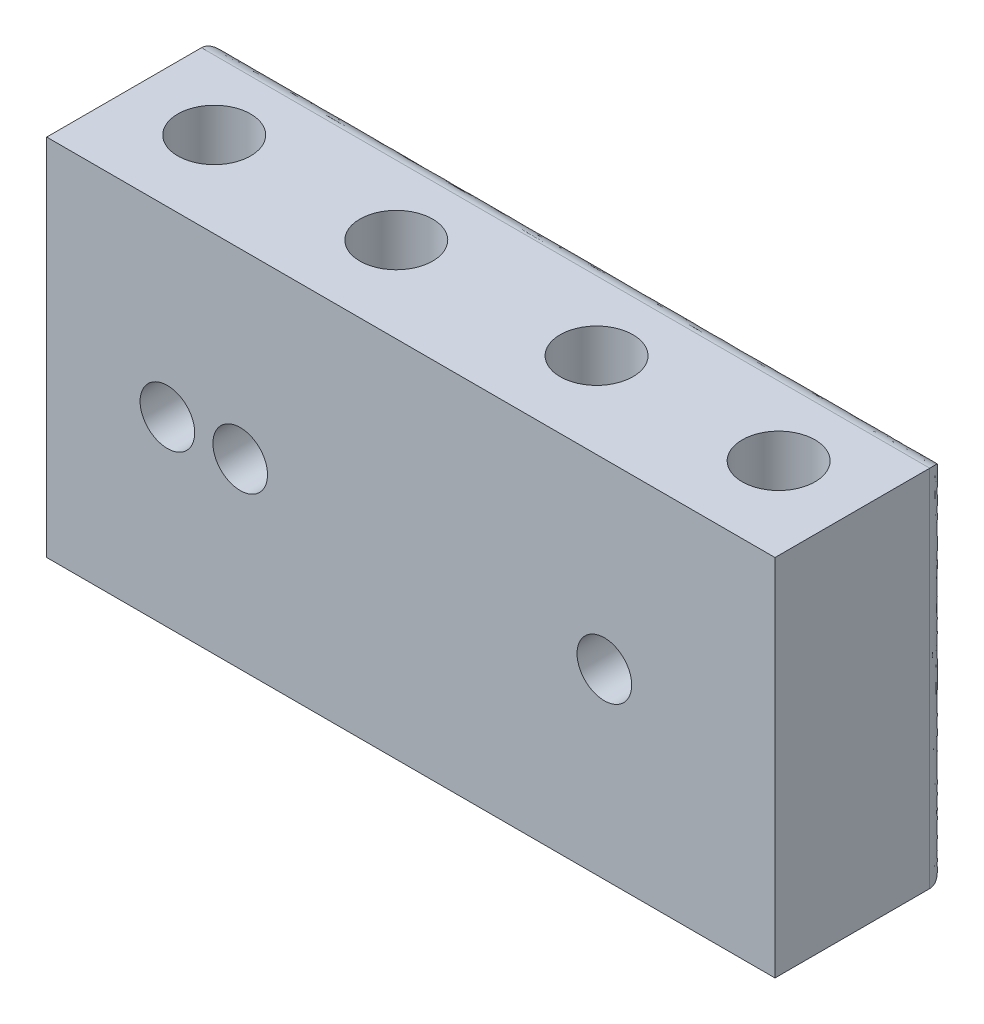
from build123d import *

# Parameters (mm, degrees)
SKETCH1_W           = 40
SKETCH1_H           = 20
BOSS_EXTRUDE1_DEPTH = 9.5
CUT_EXTRUDE1_DEPTH  = 2
FILLET1_R           = 1
SKETCH4_R           = 2
CUT_EXTRUDE2_DEPTH  = 30.837057496
SKETCH5_R           = 1.5
CUT_EXTRUDE3_DEPTH  = 25.295061227


with BuildPart() as part:
    # Sketch1 → Boss-Extrude1 (new body)
    with BuildSketch(Plane.XY):
        Rectangle(SKETCH1_W, SKETCH1_H)
    extrude(amount=BOSS_EXTRUDE1_DEPTH)

    # Sketch3 → Cut-Extrude1 (cut)
    with BuildSketch(Plane(origin=(0, 0, 0), x_dir=(-1, 0, 0), z_dir=(0, 0, -1))):
        with BuildLine():
            Line((13.371397425, -3.45), (1.371397425, -3.45))
            add(Edge.make_bspline(
                [(-6.426606991, -6.332711355), (-3.012827406, -3.55467535), (1.371397425, -3.45)],
                knots=[0, 0, 0, 1, 1, 1], degree=2))
            ThreePointArc((-6.426606991, -6.332711355), (-18.228602575, 0), (-6.426606991, 6.332711355))
            add(Edge.make_bspline(
                [(-6.426606991, 6.332711355), (-3.012827406, 3.55467535), (1.371397425, 3.45)],
                knots=[0, 0, 0, 1, 1, 1], degree=2))
            Line((1.371397425, 3.45), (13.371397425, 3.45))
            ThreePointArc((13.371397425, 3.45), (16.821397425, 0), (13.371397425, -3.45))
        make_face()
    extrude(amount=-CUT_EXTRUDE1_DEPTH, mode=Mode.SUBTRACT)

    # Fillet1
    fillet1_edges = [part.edges().sort_by_distance(p)[0] for p in [
        (-20, 0, 0),
        (0, -10, 0),
        (0, 10, 0),
        (20, 0, 0),
    ]]
    fillet(fillet1_edges, radius=FILLET1_R)

    # Sketch4 → Cut-Extrude2 (cut, through all)
    with BuildSketch(Plane(origin=(0, 10, 0), x_dir=(1, 0, 0), z_dir=(0, 1, 0))):
        with Locations((-15.5, -4.8)):
            Circle(SKETCH4_R)
        with Locations((-5.5, -4.8)):
            Circle(SKETCH4_R)
        with Locations((5.5, -4.8)):
            Circle(SKETCH4_R)
        with Locations((15.5, -4.8)):
            Circle(SKETCH4_R)
    extrude(amount=-CUT_EXTRUDE2_DEPTH, mode=Mode.SUBTRACT)

    # Sketch5 → Cut-Extrude3 (cut, through all)
    with BuildSketch(Plane(origin=(0, 0, 0), x_dir=(-1, 0, 0), z_dir=(0, 0, -1))):
        with Locations((13.371397425, 0)):
            Circle(SKETCH5_R)
        with Locations((9.371397425, 0)):
            Circle(SKETCH5_R)
        with Locations((-10.628602575, 0)):
            Circle(SKETCH5_R)
    extrude(amount=-CUT_EXTRUDE3_DEPTH, mode=Mode.SUBTRACT)


solid = part.part
